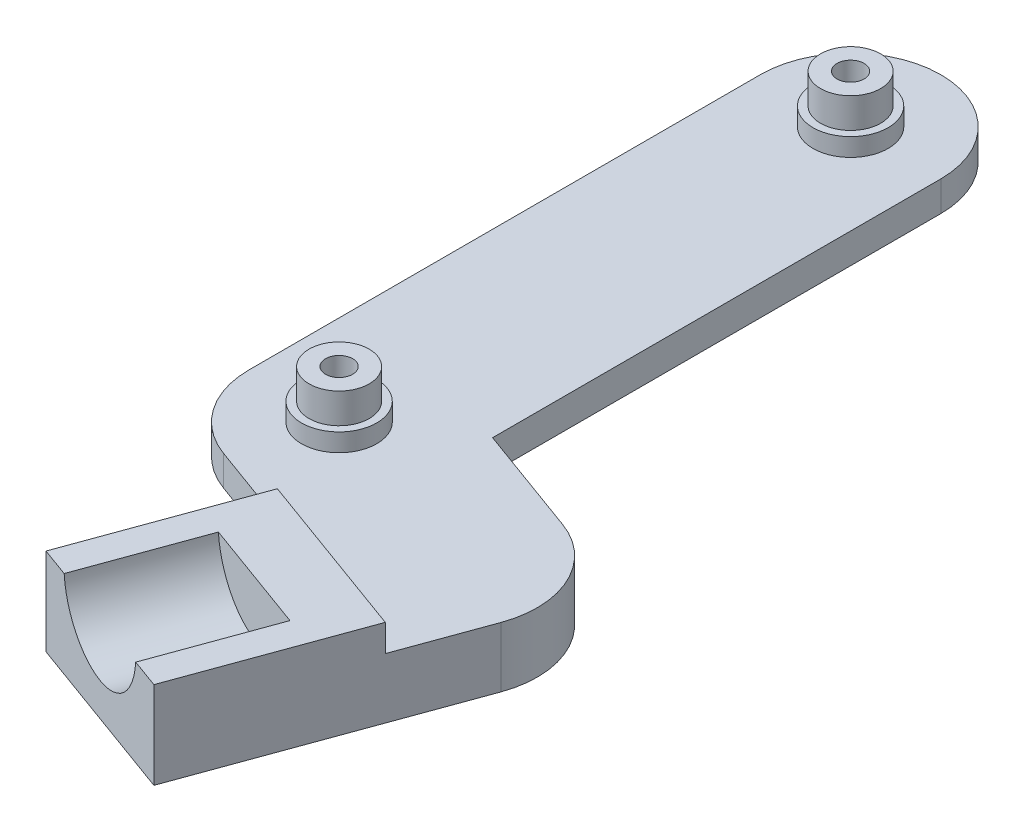
from build123d import *
from build123d.topology import SkipClean

# Parameters (mm, degrees)
EXTRUDE_1_DEPTH              = 5
SKETCH_2_R                   = 6.25
EXTRUDE_2_DEPTH              = 3
SKETCH_3_R                   = 5
EXTRUDE_3_DEPTH              = 5
HOLE_WIZARD_M4_1_D           = 4.5
HOLE_WIZARD_M4_1_CBORE_D     = 9
HOLE_WIZARD_M4_1_CBORE_DEPTH = 4
EXTRUDE_4_DEPTH              = 5
EXTRUDE_5_DEPTH              = 5
EXTRUDE_5_DEPTH_BACK         = 5
EXTRUDE_6_DEPTH              = 4.5
SKETCH_15_R                  = 10
CUT_EXTRUDE_2_DEPTH          = 20


with BuildPart() as part:
    # 스케치1 → 보스-돌출1 (new body)
    with BuildSketch(Plane(origin=(0, 0, 0), x_dir=(1, 0, 0), z_dir=(0, 1, 0))):
        with BuildLine():
            Line((-15, 0), (-15, 85))
            ThreePointArc((-15, 85), (0, 100), (15, 85))
            Line((15, 85), (15, 0))
            ThreePointArc((15, 0), (0, -15), (-15, 0))
        make_face()
    extrude(amount=EXTRUDE_1_DEPTH)

    # 스케치2 → 보스-돌출2 (add)
    with BuildSketch(Plane(origin=(0, 5, 0), x_dir=(1, 0, 0), z_dir=(0, 1, 0))):
        with Locations((0, 85)):
            Circle(SKETCH_2_R)
        Circle(SKETCH_2_R)
    extrude(amount=EXTRUDE_2_DEPTH)

    # 스케치3 → 보스-돌출3 (add)
    with BuildSketch(Plane(origin=(0, 8, 0), x_dir=(1, 0, 0), z_dir=(0, 1, 0))):
        with Locations((0, 85)):
            Circle(SKETCH_3_R)
        Circle(SKETCH_3_R)
    extrude(amount=EXTRUDE_3_DEPTH)

    # M4 남비 머리 나사용 카운터보어1 (through all)
    with Locations(Plane(origin=(0, 0, 0), x_dir=(-1, 0, 0), z_dir=(0, -1, 0))):
        with Locations((0, 85), (0, 0)):
            CounterBoreHole(HOLE_WIZARD_M4_1_D / 2, HOLE_WIZARD_M4_1_CBORE_D / 2, HOLE_WIZARD_M4_1_CBORE_DEPTH)

    # 스케치8 → 보스-돌출4 (add)
    with BuildSketch(Plane.XZ):
        with BuildLine():
            Line((-5.13030215, 14.095389312), (23.060476474, 24.355993612))
            ThreePointArc((23.060476474, 24.355993612), (42.286167935, 15.39090645), (33.321080773, -3.834785012))
            Line((33.321080773, -3.834785012), (15, -10.503113073))
            Line((15, -10.503113073), (15, 0))
            ThreePointArc((15, 0), (8.603646545, 12.287280664), (-5.13030215, 14.095389312))
        make_face()
    extrude(amount=-EXTRUDE_4_DEPTH)

    # 스케치9 → 보스-돌출5 (add, two sides: drawn at the far end of the back side and taken through both)
    with SkipClean():  # the faces are left unmerged after this step: merging them gives an invalid solid
        with BuildSketch(Plane.XZ.offset(-EXTRUDE_5_DEPTH_BACK)):
            with BuildLine():
                Line((14.095389312, 5.13030215), (3.834785012, 33.321080773))
                Line((3.834785012, 33.321080773), (-1.295517138, 47.416470085))
                Line((-1.295517138, 47.416470085), (26.895261486, 57.677074385))
                Line((26.895261486, 57.677074385), (32.025563636, 43.581685073))
                Line((32.025563636, 43.581685073), (42.286167935, 15.39090645))
                ThreePointArc((42.286167935, 15.39090645), (33.321080773, -3.834785012), (14.095389312, 5.13030215))
            make_face()
        extrude(amount=EXTRUDE_5_DEPTH + EXTRUDE_5_DEPTH_BACK)

    # 스케치13 → 보스-돌출6 (add)
    with SkipClean():  # the faces are left unmerged after this step: merging them gives an invalid solid
        with BuildSketch(Plane(origin=(0, 5, 0), x_dir=(1, 0, 0), z_dir=(0, 1, 0))):
            Polygon((37.155865785, -29.486295761), (26.895261486, -57.677074385), (-1.295517138, -47.416470085), (8.965087162, -19.225691462), align=None)
        extrude(amount=EXTRUDE_6_DEPTH)

    # 스케치15 → 컷-돌출2 (cut)
    with SkipClean():  # the faces are left unmerged after this step: merging them gives an invalid solid
        with BuildSketch(Plane(origin=(-15.39090645, 0, 42.286167935), x_dir=(0.9396926207859084, 0, 0.3420201433256689), z_dir=(-0.3420201433256689, 0, 0.9396926207859084))):
            with Locations((30, 10.5)):
                Circle(SKETCH_15_R)
        extrude(amount=-CUT_EXTRUDE_2_DEPTH, mode=Mode.SUBTRACT)


solid = part.part
